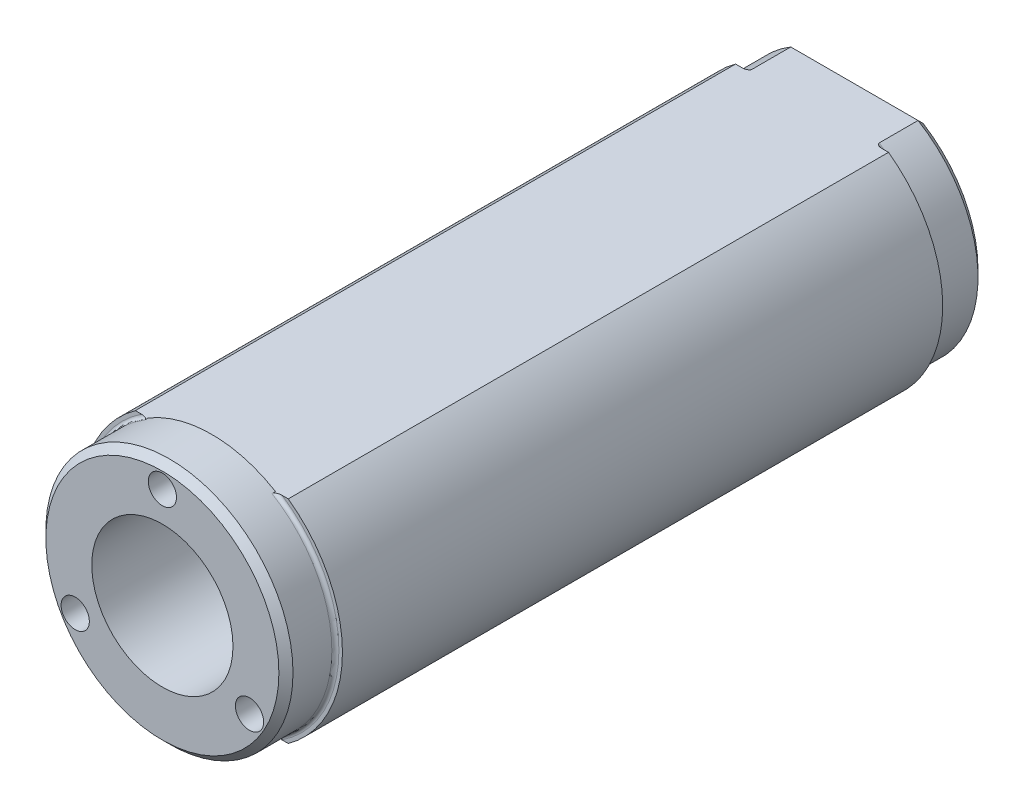
from build123d import *

# Parameters (mm, degrees)
BOSS_EXTRUDE1_DEPTH         = 49.5
BOSS_EXTRUDE1_DEPTH_BACK    = 49.5
BOSS_EXTRUDE2_DEPTH         = 42.5
BOSS_EXTRUDE2_DEPTH_BACK    = 42.5
BOSS_EXTRUDE3_START         = -7
BOSS_EXTRUDE3_DEPTH         = 7
SKETCH6_R                   = 2
SKETCH6_R_2                 = 2.0000000000012577
SKETCH6_R_3                 = 2.0000000000018354
CUT_EXTRUDE1_DEPTH          = 5
M3_TAPPED_HOLE1_D           = 2.5
M3_TAPPED_HOLE1_DEPTH       = 7.5
M3_TAPPED_HOLE1_CSINK_D     = 3.05
M3_TAPPED_HOLE1_CSINK_ANGLE = 90
M3_TAPPED_HOLE1_TIP         = 0.7510757737844503
FILLET1_R                   = 0.5
CHAMFER1_SIZE               = 1
CHAMFER2_SIZE               = 1


with BuildPart() as part:
    # Sketch1 → Boss-Extrude1 (new, two sides: drawn at the far end of the back side and taken through both)
    with BuildSketch(Plane.XY.offset(-BOSS_EXTRUDE1_DEPTH_BACK)):
        with BuildLine():
            Line((9.013878188660517, 15), (0, 15))
            Line((0, 15), (0, 10.000000000000004))
            ThreePointArc((-4.824e-14, 10.000000000000004), (7.07106781186546, 7.071067811865495), (10.000000000000004, 0))
            ThreePointArc((10.000000000000004, -2.45e-15), (7.071067811865457, -7.071067811865499), (-5.513e-14, -10.000000000000004))
            Line((0, -10.000000000000007), (0, -15))
            Line((0, -14.999999999999998), (9.013878188660513, -14.999999999999996))
            ThreePointArc((9.013878188660447, -14.999999999999721), (15.231429156542696, -8.617050878880846), (17.500000000000004, -4.29e-15))
            ThreePointArc((17.500000000000004, 0), (15.231429156542696, 8.617050878880846), (9.013878188660442, 14.999999999999723))
        make_face()
        with BuildLine():
            Line((0, 10.000000000000004), (0, 15))
            Line((0, 15), (-9.013878188659975, 15))
            ThreePointArc((-9.013878188659975, 15.000000000000002), (-17.500000000000004, 1.769e-14), (-9.01387818866, -14.99999999999999))
            Line((-9.013878188659985, -15), (0, -14.999999999999998))
            Line((0, -15), (0, -10.000000000000007))
            ThreePointArc((-5.513e-14, -10.000000000000004), (-10.000000000000004, 1.22e-15), (-4.824e-14, 10.000000000000004))
        make_face()
    extrude(amount=BOSS_EXTRUDE1_DEPTH + BOSS_EXTRUDE1_DEPTH_BACK)

    # Sketch1<23> → Boss-Extrude2 (add, two sides: drawn at the far end of the back side and taken through both)
    with BuildSketch(Plane.XY.offset(-BOSS_EXTRUDE2_DEPTH_BACK)):
        with BuildLine():
            Line((-9.013878188659975, 15), (-10.828203913853855, 15))
            ThreePointArc((-10.828203913853855, 15.000000000000004), (-18.5, -5.95e-15), (-10.828203913853852, -15.000000000000005))
            Line((-10.828203913853855, -15), (-9.013878188659985, -15))
            ThreePointArc((-9.01387818866, -14.99999999999999), (-17.500000000000004, 1.769e-14), (-9.013878188659975, 15.000000000000002))
        make_face()
        with BuildLine():
            ThreePointArc((18.5, 0), (16.470758519362374, 8.424020049646833), (10.828203913853855, 15))
            Line((10.828203913853855, 15), (9.013878188660517, 15))
            ThreePointArc((9.013878188660442, 14.999999999999723), (15.231429156542696, 8.617050878880846), (17.500000000000004, 0))
            ThreePointArc((17.500000000000004, -4.29e-15), (15.231429156542696, -8.617050878880846), (9.013878188660447, -14.999999999999721))
            Line((9.013878188660513, -14.999999999999996), (10.828203913853855, -14.999999999999996))
            ThreePointArc((10.828203913853848, -15.000000000000009), (16.47075851936237, -8.42402004964684), (18.5, -4.53e-15))
        make_face()
    extrude(amount=BOSS_EXTRUDE2_DEPTH + BOSS_EXTRUDE2_DEPTH_BACK)

    # Sketch5 → Boss-Extrude3 (add)
    with BuildSketch(Plane.XY.offset(49.5).offset(BOSS_EXTRUDE3_START)):
        with BuildLine():
            ThreePointArc((9.013878188660444, 14.999999999999721), (2.7267e-13, 17.500000000000004), (-9.013878188659977, 15.000000000000002))
            Line((-9.013878188659975, 15), (9.013878188660518, 14.99999999999984))
        make_face()
        with BuildLine():
            ThreePointArc((-9.013878188659985, -14.999999999999998), (2.6645e-13, -17.500000000000007), (9.01387818866044, -14.999999999999726))
            Line((9.013878188660513, -14.999999999999838), (-9.013878188659987, -14.999999999999998))
        make_face()
    extrude(amount=BOSS_EXTRUDE3_DEPTH)

    # Sketch6 → Cut-Extrude1 (cut)
    with BuildSketch(Plane.XY.offset(49.5)):
        with Locations((0, 14.25)):
            Circle(SKETCH6_R)
        with Locations((12.340862003929768, -7.124999999999125)):
            Circle(SKETCH6_R_2)
        with Locations((-12.340862003926736, -7.12500000000088)):
            Circle(SKETCH6_R_3)
    extrude(amount=-CUT_EXTRUDE1_DEPTH, mode=Mode.SUBTRACT)

    # M3 Tapped Hole1
    with Locations(Plane(origin=(2.4e-15, -14.999999999999998, 0), x_dir=(-1, -1.6e-16, 0), z_dir=(1.6e-16, -1, 0))):
        with Locations((0, 0)):
            CounterSinkHole(M3_TAPPED_HOLE1_D / 2, M3_TAPPED_HOLE1_CSINK_D / 2, depth=M3_TAPPED_HOLE1_DEPTH, counter_sink_angle=M3_TAPPED_HOLE1_CSINK_ANGLE)
            with Locations((0, 0, -(M3_TAPPED_HOLE1_DEPTH + M3_TAPPED_HOLE1_TIP / 2))):  # 118° drill point
                Cone(0, M3_TAPPED_HOLE1_D / 2, M3_TAPPED_HOLE1_TIP, mode=Mode.SUBTRACT)

    # Fillet1
    # the kernel refuses this fillet: 0.5 mm, written as the material it adds along each edge
    with BuildSketch(Plane(origin=(-1.421e-14, 5.77e-15, 42.5), x_dir=(0.45254890557349203, -0.8917395853410538, 0), z_dir=(-0.8917395853410538, -0.45254890557349203, 0))) as fillet1_piece_1_section:
        with BuildLine():
            CenterArc((17.500000000000018 + FILLET1_R, FILLET1_R), FILLET1_R, 180, 90)
            Line((17.500000000000018 + FILLET1_R, 0), (17.500000000000018, 0))
            Line((17.500000000000018, 0), (17.500000000000018, FILLET1_R))
        make_face()
    fillet1_piece_1 = revolve(axis=Axis((-1.421e-14, 5.77e-15, 42.5), (0, 0, 1)), revolution_arc=126.18532587010755, mode=Mode.PRIVATE)
    fillet1_piece_1 = split(fillet1_piece_1, bisect_by=Plane(origin=(17.637648609148254, 15, 42.63764860914824), z_dir=(0, -1, 0)), keep=Keep.TOP, mode=Mode.PRIVATE)
    fillet1_piece_1 = split(fillet1_piece_1, bisect_by=Plane(origin=(17.637648609148258, -14.999999999999995, 42.63764860914824), z_dir=(-2e-16, 1, 0)), keep=Keep.TOP, mode=Mode.PRIVATE)
    add(fillet1_piece_1)
    with BuildSketch(Plane(origin=(-1.066e-14, -6.22e-15, -42.5), x_dir=(0.4525489055734917, 0.891739585341054, 0), z_dir=(-0.891739585341054, 0.4525489055734917, 0))) as fillet1_piece_2_section:
        with BuildLine():
            CenterArc((17.50000000000003 + FILLET1_R, FILLET1_R), FILLET1_R, 180, 90)
            Line((17.50000000000003 + FILLET1_R, 0), (17.50000000000003, 0))
            Line((17.50000000000003, 0), (17.50000000000003, FILLET1_R))
        make_face()
    fillet1_piece_2 = revolve(axis=Axis((-1.066e-14, -6.22e-15, -42.5), (0, 0, -1)), revolution_arc=126.18532587010758, mode=Mode.PRIVATE)
    fillet1_piece_2 = split(fillet1_piece_2, bisect_by=Plane(origin=(17.63764860914827, 15, -42.63764860914825), z_dir=(0, -1, 0)), keep=Keep.TOP, mode=Mode.PRIVATE)
    fillet1_piece_2 = split(fillet1_piece_2, bisect_by=Plane(origin=(17.637648609148272, -14.999999999999995, -42.63764860914825), z_dir=(-2e-16, 1, 0)), keep=Keep.TOP, mode=Mode.PRIVATE)
    add(fillet1_piece_2)
    with BuildSketch(Plane(origin=(1.78e-15, -1.33e-15, 42.5), x_dir=(-0.4525489055734672, -0.8917395853410666, 0), z_dir=(0.8917395853410666, -0.4525489055734672, 0))) as fillet1_piece_3_section:
        with BuildLine():
            CenterArc((17.50000000000002 + FILLET1_R, -FILLET1_R), FILLET1_R, 90, 90)
            Line((17.50000000000002 + FILLET1_R, 0), (17.50000000000002, 0))
            Line((17.50000000000002, 0), (17.50000000000002, -FILLET1_R))
        make_face()
    fillet1_piece_3 = revolve(axis=Axis((1.78e-15, -1.33e-15, 42.5), (0, 0, -1)), revolution_arc=126.18532587011086, mode=Mode.PRIVATE)
    fillet1_piece_3 = split(fillet1_piece_3, bisect_by=Plane(origin=(-17.637648609148275, 15, 42.63764860914824), z_dir=(0, -1, 0)), keep=Keep.TOP, mode=Mode.PRIVATE)
    fillet1_piece_3 = split(fillet1_piece_3, bisect_by=Plane(origin=(-17.637648609148272, -15.000000000000002, 42.63764860914824), z_dir=(-2e-16, 1, 0)), keep=Keep.TOP, mode=Mode.PRIVATE)
    add(fillet1_piece_3)
    with BuildSketch(Plane(origin=(1.78e-15, -1.33e-15, -42.5), x_dir=(-0.4525489055734672, -0.8917395853410666, 0), z_dir=(0.8917395853410666, -0.4525489055734672, 0))) as fillet1_piece_4_section:
        with BuildLine():
            CenterArc((17.500000000000007 + FILLET1_R, FILLET1_R), FILLET1_R, 180, 90)
            Line((17.50000000000001, FILLET1_R), (17.500000000000007, 0))
            Line((17.500000000000007, 0), (17.500000000000007 + FILLET1_R, 0))
        make_face()
    fillet1_piece_4 = revolve(axis=Axis((1.78e-15, -1.33e-15, -42.5), (0, 0, -1)), revolution_arc=126.18532587011086, mode=Mode.PRIVATE)
    fillet1_piece_4 = split(fillet1_piece_4, bisect_by=Plane(origin=(-17.637648609147508, 15, -42.6376486091475), z_dir=(0, -1, 0)), keep=Keep.TOP, mode=Mode.PRIVATE)
    fillet1_piece_4 = split(fillet1_piece_4, bisect_by=Plane(origin=(-17.637648609147504, -15.000000000000002, -42.6376486091475), z_dir=(-2e-16, 1, 0)), keep=Keep.TOP, mode=Mode.PRIVATE)
    add(fillet1_piece_4)

    # Chamfer1
    chamfer1_edges = [part.edges().sort_by_distance(p)[0] for p in [
        (9.01387818866, 14.99999999999999, 49.5),
        (-17.500000000000007, 1.066e-14, -49.5),
        (17.500000000000004, 5.77e-15, -49.5),
    ]]
    chamfer(chamfer1_edges, length=CHAMFER1_SIZE)

    # Chamfer2
    chamfer2_edges = [part.edges().sort_by_distance(p)[0] for p in [
        (1.78e-15, -14.999999999999927, -49.5),
        (1.421e-14, 14.999999999999932, -49.5),
    ]]
    chamfer(chamfer2_edges, length=CHAMFER2_SIZE)


solid = part.part
